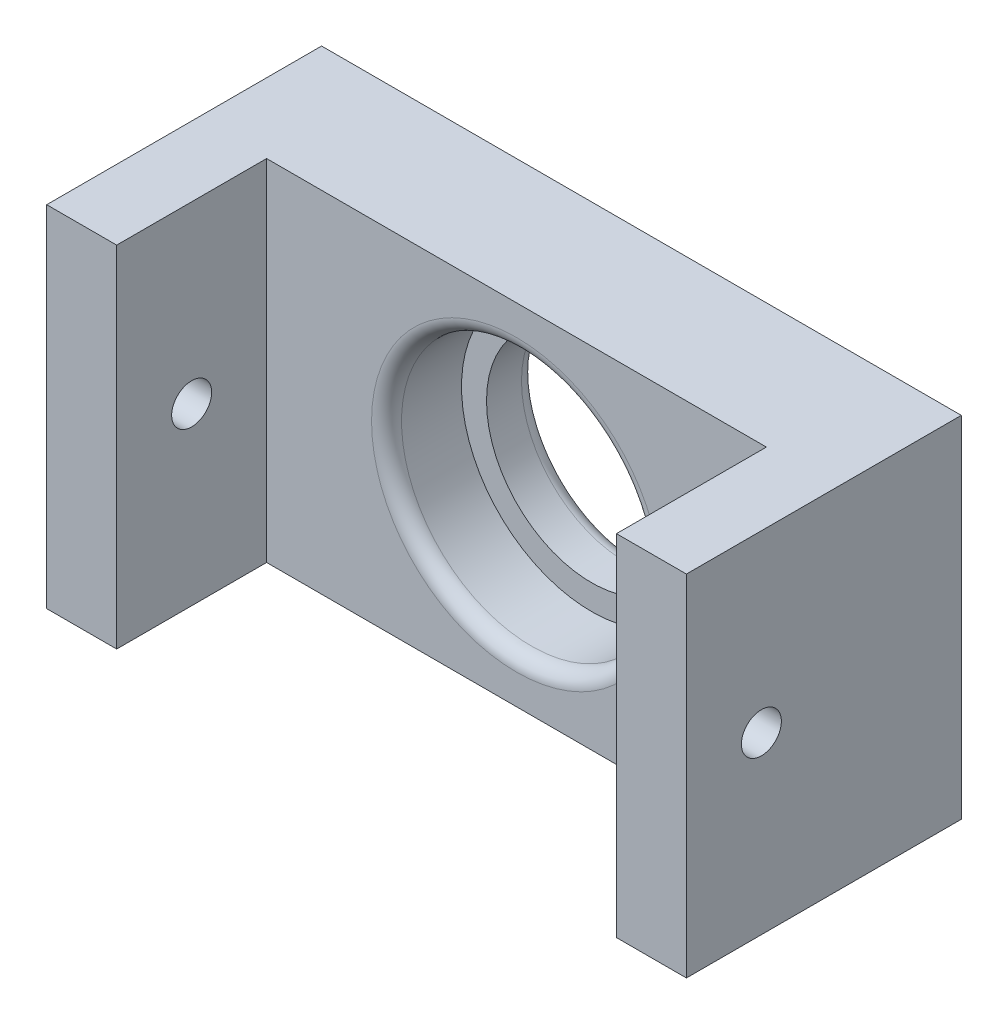
from build123d import *

# Parameters (mm, degrees)
SZKIC2_W                    = 64
SZKIC2_H                    = 35
SZKIC2_R                    = 10.5
DODANIE_WYCI_GNI_CIE1_DEPTH = 12.5
SZKIC3_R                    = 13
WYTNIJ_WYCI_GNI_CIE1_DEPTH  = 7.5
SZKIC4_W                    = 7
SZKIC4_H                    = 35
DODANIE_WYCI_GNI_CIE2_DEPTH = 15
SZKIC6_R                    = 2
WYTNIJ_WYCI_GNI_CIE2_DEPTH  = 7
WYTNIJ_WYCI_GNI_CIE3_START  = -7
SZKIC7_R                    = 2
WYTNIJ_WYCI_GNI_CIE3_DEPTH  = 7
ZAOKR_GLENIE2_R             = 1.5
ZAOKR_GLENIE3_R             = 1.5


with BuildPart() as part:
    # Szkic2 → Dodanie-wyciągnięcie1 (new body)
    with BuildSketch(Plane.XY):
        Rectangle(SZKIC2_W, SZKIC2_H)
        Circle(SZKIC2_R, mode=Mode.SUBTRACT)
    extrude(amount=DODANIE_WYCI_GNI_CIE1_DEPTH)

    # Szkic3 → Wytnij-wyciągnięcie1 (cut)
    with BuildSketch(Plane.XY.offset(12.5)):
        Circle(SZKIC3_R)
    extrude(amount=-WYTNIJ_WYCI_GNI_CIE1_DEPTH, mode=Mode.SUBTRACT)

    # Szkic4 → Dodanie-wyciągnięcie2 (add)
    with BuildSketch(Plane.XY.offset(12.5)):
        with Locations((-28.5, 0)):
            Rectangle(SZKIC4_W, SZKIC4_H)
        with Locations((28.5, 0)):
            Rectangle(SZKIC4_W, SZKIC4_H)
    extrude(amount=DODANIE_WYCI_GNI_CIE2_DEPTH)

    # Szkic6 → Wytnij-wyciągnięcie2 (cut)
    with BuildSketch(Plane.ZY.offset(-25)):
        with Locations((20, 0)):
            Circle(SZKIC6_R)
    extrude(amount=-WYTNIJ_WYCI_GNI_CIE2_DEPTH, mode=Mode.SUBTRACT)

    # Szkic7 → Wytnij-wyciągnięcie3 (cut)
    with BuildSketch(Plane(origin=(-25, 0, 0), x_dir=(0, 0, -1), z_dir=(1, 0, 0)).offset(WYTNIJ_WYCI_GNI_CIE3_START)):
        with Locations((-20, 0)):
            Circle(SZKIC7_R)
    extrude(amount=WYTNIJ_WYCI_GNI_CIE3_DEPTH, mode=Mode.SUBTRACT)

    # Zaokrąglenie2
    zaokr_glenie2_edges = [part.edges().sort_by_distance(p)[0] for p in [
        (-13, 0, 12.5),
    ]]
    fillet(zaokr_glenie2_edges, radius=ZAOKR_GLENIE2_R)

    # Zaokrąglenie3
    zaokr_glenie3_edges = [part.edges().sort_by_distance(p)[0] for p in [
        (-10.5, 0, 0),
    ]]
    fillet(zaokr_glenie3_edges, radius=ZAOKR_GLENIE3_R)


solid = part.part
